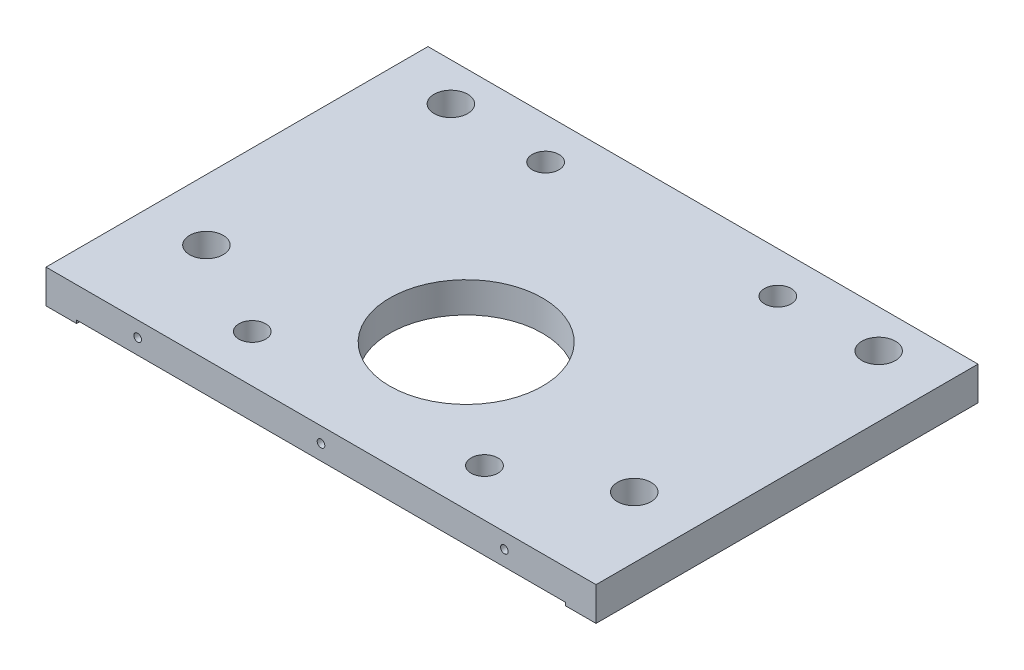
from build123d import *

# Parameters (mm, degrees)
SKETCH_1_W                  = 360
SKETCH_1_H                  = 250
EXTRUDE_1_DEPTH             = 22
CUT_EXTRUDE_1_REACH         = 222.248
SKETCH_2_R                  = 50
SKETCH_2_R_2                = 11
SKETCH_3_W                  = 320
SKETCH_3_H                  = 250
CUT_EXTRUDE_2_DEPTH         = 2
PATTERN_START               = 2
PATTERN_LINEAR_1_OUTLINE_R  = 11
PATTERN_LINEAR_1_DEPTH      = 20
HOLE_WIZARD_M20_1_D         = 17.5
PATTERN_LINEAR_2_COUNT      = 2
PATTERN_LINEAR_2_PITCH      = 192
PATTERN_LINEAR_2_COUNT_DIR2 = 2
PATTERN_LINEAR_2_PITCH_DIR2 = 152
HOLE_WIZARD_M6_1_AT_2_COUNT = 2
HOLE_WIZARD_M6_1_AT_2_PITCH = 120
HOLE_WIZARD_M6_1_AT_3_COUNT = 2
HOLE_WIZARD_M6_1_AT_3_PITCH = 240


# Read off the part's stored shape, not the designer's step: 阵列(线性)1
with BuildPart() as part:
    # 草图1 → 凸台-拉伸1 (new body)
    with BuildSketch(Plane(origin=(0, 0, 0), x_dir=(1, 0, 0), z_dir=(0, 1, 0))):
        Rectangle(SKETCH_1_W, SKETCH_1_H)
    extrude(amount=EXTRUDE_1_DEPTH)

    # 草图2 → 切除-拉伸1 (cut, up to next)
    with BuildSketch(Plane.XZ, mode=Mode.PRIVATE) as cut_extrude_1_sk1:
        with Locations(Location((0, 30, 0), (0, 0, 270))):
            Circle(SKETCH_2_R)
    cut_extrude_1_tool1 = extrude(cut_extrude_1_sk1.sketch, amount=-CUT_EXTRUDE_1_REACH, mode=Mode.PRIVATE) & part.part
    # 草图2 → 切除-拉伸1 (cut, up to next)
    with BuildSketch(Plane.XZ, mode=Mode.PRIVATE) as cut_extrude_1_sk2:
        with Locations(Location((-140, 60, 0), (0, 0, 270))):
            Circle(SKETCH_2_R_2)
    cut_extrude_1_tool2 = extrude(cut_extrude_1_sk2.sketch, amount=-CUT_EXTRUDE_1_REACH, mode=Mode.PRIVATE) & part.part
    add(cut_extrude_1_tool1.solids().sort_by_distance((0, 0, 30))[0], mode=Mode.SUBTRACT)
    add(cut_extrude_1_tool2.solids().sort_by_distance((-140, 0, 60))[0], mode=Mode.SUBTRACT)

    # 草图3 → 切除-拉伸2 (cut)
    with BuildSketch(Plane.XZ):
        Rectangle(SKETCH_3_W, SKETCH_3_H)
    extrude(amount=-CUT_EXTRUDE_2_DEPTH, mode=Mode.SUBTRACT)

    # 阵列(线性)1 outline → 阵列(线性)1 (cut)
    with BuildSketch(Plane(origin=(0, 0, 0), x_dir=(1, 0, 0), z_dir=(0, 1, 0)).offset(PATTERN_START)):
        with Locations((140, 100)):
            Circle(PATTERN_LINEAR_1_OUTLINE_R)
        with Locations((-140, 100)):
            Circle(PATTERN_LINEAR_1_OUTLINE_R)
        with Locations((140, -60)):
            Circle(PATTERN_LINEAR_1_OUTLINE_R)
    extrude(amount=PATTERN_LINEAR_1_DEPTH, mode=Mode.SUBTRACT)

    # M20 螺纹孔1 (through all)
    with Locations(Plane(origin=(0, 2, 0), x_dir=(-1, 0, 0), z_dir=(0, -1, 0))):
        with Locations((76, -94)):
            hole_wizard_m20_1 = Hole(HOLE_WIZARD_M20_1_D / 2)

    # 阵列(线性)2: Hole Wizard M20 _1 2 × 2
    with Locations(*[(j * PATTERN_LINEAR_2_PITCH_DIR2, 0, -i * PATTERN_LINEAR_2_PITCH) for i in range(PATTERN_LINEAR_2_COUNT) for j in range(PATTERN_LINEAR_2_COUNT_DIR2) if (i, j) != (0, 0)]):
        add(hole_wizard_m20_1, mode=Mode.SUBTRACT)

    # 草图7 → M6 螺纹孔1 (revolve, cut)
    with BuildSketch(Plane(origin=(120, 12, -125), x_dir=(0, 1, 0), z_dir=(1, 0, 0))):
        Polygon((0, 0), (0, 16.502151548), (2.5, 15), (2.5, 0), align=None)
    hole_wizard_m6_1 = revolve(axis=Axis((120, 12, -131.35), (0, 0, 1)), mode=Mode.SUBTRACT)

    # M6 螺纹孔1 at 2: M6 螺纹孔1 ×2
    with Locations(*[(-i * HOLE_WIZARD_M6_1_AT_2_PITCH, 0, 0) for i in range(1, HOLE_WIZARD_M6_1_AT_2_COUNT)]):
        add(hole_wizard_m6_1, mode=Mode.SUBTRACT)

    # M6 螺纹孔1 at 3: M6 螺纹孔1 ×2
    with Locations(*[(-i * HOLE_WIZARD_M6_1_AT_3_PITCH, 0, 0) for i in range(1, HOLE_WIZARD_M6_1_AT_3_COUNT)]):
        add(hole_wizard_m6_1, mode=Mode.SUBTRACT)

    # 镜向1: M6 螺纹孔1 across plane
    add(hole_wizard_m6_1.mirror(Plane.XY), mode=Mode.SUBTRACT)

    # 镜向1 copy 1 sketch → 镜向1 copy 1 (revolve, cut)
    with BuildSketch(Plane(origin=(0, 12, 125), x_dir=(0, 1, 0), z_dir=(1, 0, 0))):
        Polygon((0, 0), (0, -16.502151548), (2.5, -15), (2.5, 0), align=None)
    revolve(axis=Axis((0, 12, 131.35), (0, 0, 1)), mode=Mode.SUBTRACT)

    # 镜向1 copy 2 sketch → 镜向1 copy 2 (revolve, cut)
    with BuildSketch(Plane(origin=(-120, 12, 125), x_dir=(0, 1, 0), z_dir=(1, 0, 0))):
        Polygon((0, 0), (0, -16.502151548), (2.5, -15), (2.5, 0), align=None)
    revolve(axis=Axis((-120, 12, 131.35), (0, 0, 1)), mode=Mode.SUBTRACT)


solid = part.part
